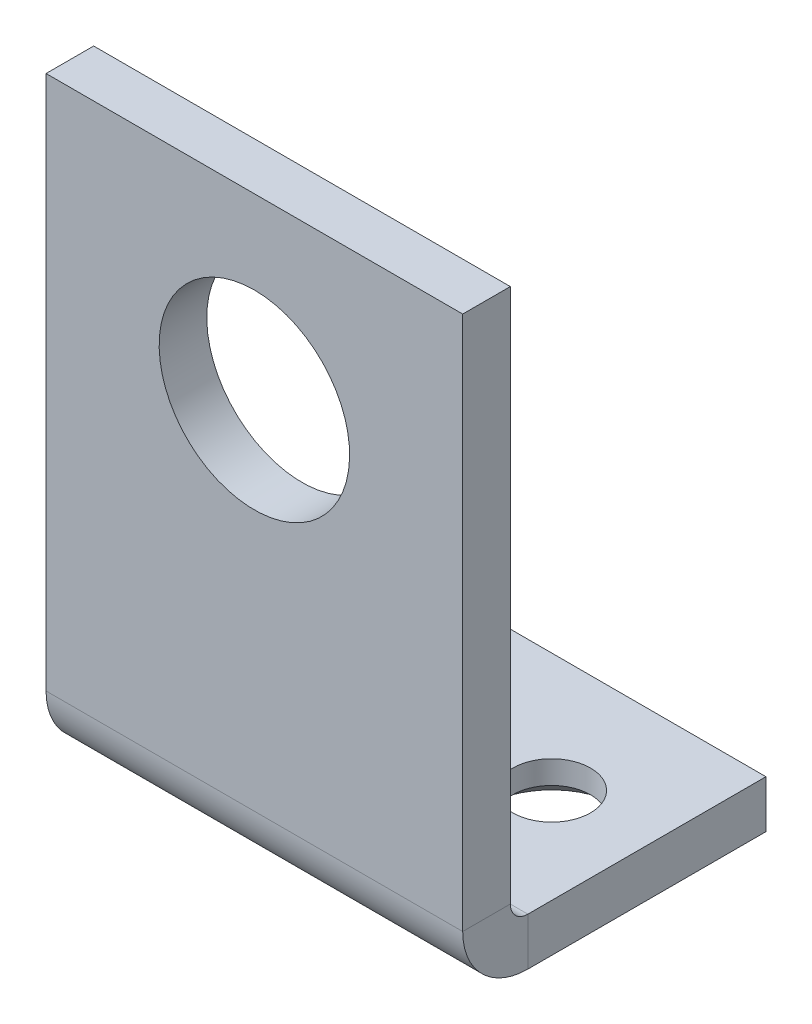
from build123d import *

# Parameters (mm, degrees)
SKETCH1_W                                         = 17.5
SKETCH1_H                                         = 35
BASE_FLANGE1_DEPTH                                = 2
SKETCH11_R                                        = 4
CUT_EXTRUDE3_DEPTH                                = 2
SKETCHED_START                                    = -23.286713287
SKETCHED_BEND3_DEPTH                              = 17.5
SKETCHED_BEND3_2_DEPTH                            = 4.7499999
SKETCHED_START_2                                  = -10.536713187
SKETCHED_BEND3_3_DEPTH                            = 4.7499999
SKETCHED_START_3                                  = -18.536713387
SKETCHED_BEND3_4_DEPTH                            = 8.0000002
SKETCHED_START_4                                  = -10.59323683
SKETCHED_BEND3_5_OUTLINE_R                        = 4
SKETCHED_BEND3_5_DEPTH                            = 2
CSK_FOR_4_FLAT_HEAD_MACHINE_SCREW_100_D           = 3.2639
CSK_FOR_4_FLAT_HEAD_MACHINE_SCREW_100_DEPTH       = 2
CSK_FOR_4_FLAT_HEAD_MACHINE_SCREW_100_CSINK_D     = 5.715
CSK_FOR_4_FLAT_HEAD_MACHINE_SCREW_100_CSINK_ANGLE = 100
CSK_FOR_4_FLAT_HEAD_MACHINE_SCREW_100_TIP         = 0.980574487


with BuildPart() as part:
    # Base-Flange1: sheet metal written as solids
    # Sketch1 → Base-Flange1 (new body)
    with BuildSketch(Plane(origin=(0, 0, 0), x_dir=(1, 0, 0), z_dir=(0, 1, 0))):
        with Locations((-14.536713287, 3.82983683)):
            Rectangle(SKETCH1_W, SKETCH1_H)
    extrude(amount=-BASE_FLANGE1_DEPTH)

    # Sketch11 → Cut-Extrude3 (cut)
    with BuildSketch(Plane(origin=(0, 0, 0), x_dir=(1, 0, 0), z_dir=(0, 1, 0))):
        with Locations(Location((-14.536713287, -6.17016317, 0), (0, 0, 270))):
            Circle(SKETCH11_R)
    extrude(amount=-CUT_EXTRUDE3_DEPTH, mode=Mode.SUBTRACT)

    # Sketched Bend3: read off the stored shape, not the designer's step
    # Sketched Bend3 outline → Sketched Bend3 (cut)
    with BuildSketch(Plane.YZ.offset(SKETCHED_START)):
        with BuildLine():
            ThreePointArc((-2, -11.32983683), (-1.443395312, -9.675569621), (0, -8.694234432))
            Line((0, -8.694234432), (0, 13.67016317))
            Line((0, 13.67016317), (-2, 13.67016317))
            Line((-2, 13.67016317), (-2, -11.32983683))
        make_face()
    extrude(amount=SKETCHED_BEND3_DEPTH, mode=Mode.SUBTRACT)

    # Sketched Bend3 2 outline → Sketched Bend3 2 (add)
    with BuildSketch(Plane.YZ.offset(SKETCHED_START)):
        with BuildLine():
            ThreePointArc((0, -11.32983683), (0.215745145, -10.808981975), (0.7366, -10.59323683))
            Line((0.7366, -10.59323683), (23.197250658, -10.59323683))
            Line((23.197250658, -10.59323683), (23.197250658, -8.59323683))
            Line((23.197250658, -8.59323683), (0.7366, -8.59323683))
            ThreePointArc((0.7366, -8.59323683), (0.364854094, -8.6186038), (0, -8.694234432))
            Line((0, -8.694234432), (0, -11.32983683))
        make_face()
    extrude(amount=SKETCHED_BEND3_2_DEPTH)

    # Sketched Bend3 3 outline → Sketched Bend3 3 (add)
    with BuildSketch(Plane.YZ.offset(SKETCHED_START_2)):
        with BuildLine():
            ThreePointArc((0, -11.32983683), (0.215745145, -10.808981975), (0.7366, -10.59323683))
            Line((0.7366, -10.59323683), (23.197250658, -10.59323683))
            Line((23.197250658, -10.59323683), (23.197250658, -8.59323683))
            Line((23.197250658, -8.59323683), (0.7366, -8.59323683))
            ThreePointArc((0.7366, -8.59323683), (0.364854094, -8.6186038), (0, -8.694234432))
            Line((0, -8.694234432), (0, -11.32983683))
        make_face()
    extrude(amount=SKETCHED_BEND3_3_DEPTH)

    # Sketched Bend3 4 outline → Sketched Bend3 4 (add)
    with BuildSketch(Plane.YZ.offset(SKETCHED_START_3)):
        with BuildLine():
            ThreePointArc((0, -11.32983683), (0.215745145, -10.808981975), (0.7366, -10.59323683))
            Line((0.7366, -10.59323683), (23.197250658, -10.59323683))
            Line((23.197250658, -10.59323683), (23.197250658, -8.59323683))
            Line((23.197250658, -8.59323683), (0.7366, -8.59323683))
            ThreePointArc((0.7366, -8.59323683), (0.364854094, -8.6186038), (0, -8.694234432))
            Line((0, -8.694234432), (0, -11.32983683))
        make_face()
    extrude(amount=SKETCHED_BEND3_4_DEPTH)

    # Sketched Bend3 5 outline → Sketched Bend3 5 (cut)
    with BuildSketch(Plane.XY.offset(SKETCHED_START_4)):
        with Locations((-14.536713287, 15.697250658)):
            Circle(SKETCHED_BEND3_5_OUTLINE_R)
    extrude(amount=SKETCHED_BEND3_5_DEPTH, mode=Mode.SUBTRACT)

    # CSK for #4 Flat Head Machine Screw (100)2
    with Locations(Plane.XZ.offset(2)):
        with Locations((-9.786713287, -16.32983683), (-19.286713287, -16.32983683)):
            CounterSinkHole(CSK_FOR_4_FLAT_HEAD_MACHINE_SCREW_100_D / 2, CSK_FOR_4_FLAT_HEAD_MACHINE_SCREW_100_CSINK_D / 2, depth=CSK_FOR_4_FLAT_HEAD_MACHINE_SCREW_100_DEPTH, counter_sink_angle=CSK_FOR_4_FLAT_HEAD_MACHINE_SCREW_100_CSINK_ANGLE)
            with Locations((0, 0, -(CSK_FOR_4_FLAT_HEAD_MACHINE_SCREW_100_DEPTH + CSK_FOR_4_FLAT_HEAD_MACHINE_SCREW_100_TIP / 2))):  # 118° drill point
                Cone(0, CSK_FOR_4_FLAT_HEAD_MACHINE_SCREW_100_D / 2, CSK_FOR_4_FLAT_HEAD_MACHINE_SCREW_100_TIP, mode=Mode.SUBTRACT)


solid = part.part
